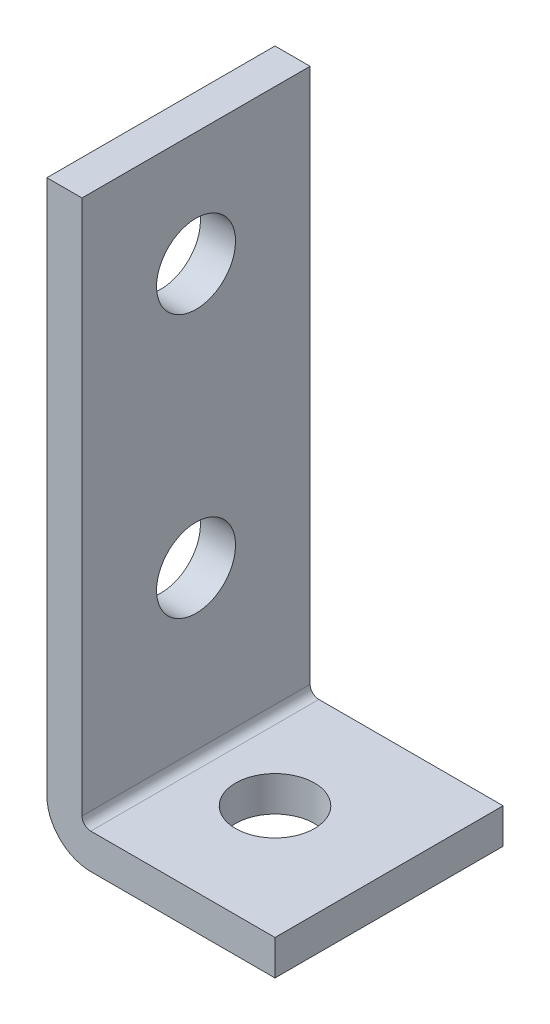
from build123d import *

# Parameters (mm, degrees)
EXTRUDE_THIN1_DEPTH = 20.6375
SKETCH2_R           = 7.14375
CUT_EXTRUDE1_DEPTH  = 109.706083805
SKETCH3_R           = 7.14375
CUT_EXTRUDE2_DEPTH  = 113.354183973


with BuildPart() as part:
    # Sketch1 → Extrude-Thin1 (new, symmetric)
    with BuildSketch(Plane.XY):
        with BuildLine():
            Line((0, 104.775), (0, 7.9375))
            ThreePointArc((0, 7.9375), (2.324839924, 2.324839924), (7.9375, 0))
            Line((7.9375, 0), (41.275, 0))
            Line((41.275, 0), (41.275, 6.35))
            Line((41.275, 6.35), (7.9375, 6.35))
            ThreePointArc((7.9375, 6.35), (6.814967985, 6.814967985), (6.35, 7.9375))
            Line((6.35, 7.9375), (6.35, 104.775))
            Line((6.35, 104.775), (0, 104.775))
        make_face()
    extrude(amount=EXTRUDE_THIN1_DEPTH, both=True)

    # Sketch2 → Cut-Extrude1 (cut, through all)
    with BuildSketch(Plane(origin=(0, 6.35, 0), x_dir=(1, 0, 0), z_dir=(0, 1, 0))):
        with Locations((20.6375, 0)):
            Circle(SKETCH2_R)
    extrude(amount=-CUT_EXTRUDE1_DEPTH, mode=Mode.SUBTRACT)

    # Sketch3 → Cut-Extrude2 (cut, through all)
    with BuildSketch(Plane(origin=(6.35, 0, 0), x_dir=(0, 0, -1), z_dir=(1, 0, 0))):
        with Locations((0, 84.1375)):
            Circle(SKETCH3_R)
        with Locations((0, 36.5125)):
            Circle(SKETCH3_R)
    extrude(amount=-CUT_EXTRUDE2_DEPTH, mode=Mode.SUBTRACT)


solid = part.part
